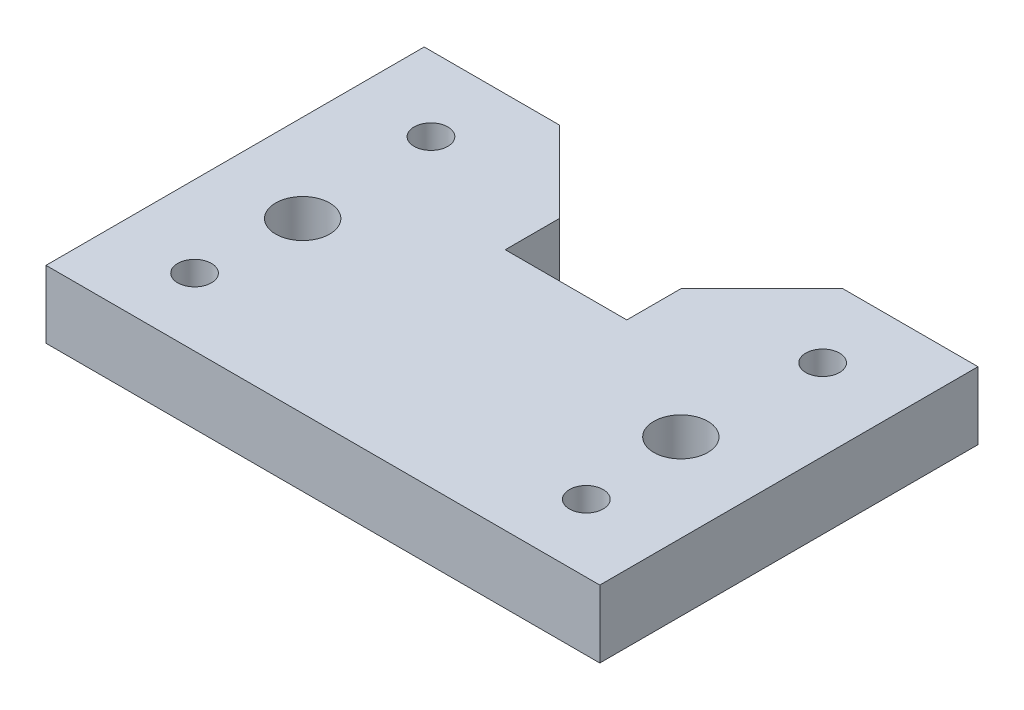
from build123d import *

# Parameters (mm, degrees)
SKETCH1_W               = 82
SKETCH1_H               = 10
BOSS_EXTRUDE1_DEPTH     = 35
CUT_EXTRUDE1_DEPTH      = 55.827000647
CUT_EXTRUDE1_DEPTH_BACK = 55.827000647
SKETCH2_R               = 4
CUT_EXTRUDE2_DEPTH      = 55.827000647
CUT_EXTRUDE2_DEPTH_BACK = 55.827000647
SKETCH3_R               = 2.5
SKETCH4_W               = 82
SKETCH4_H               = 10
BOSS_EXTRUDE2_DEPTH     = 21
CUT_EXTRUDE3_DEPTH      = 55.827000647
CUT_EXTRUDE3_DEPTH_BACK = 55.827000647
SKETCH5_R               = 2.5
CUT_EXTRUDE4_DEPTH      = 4
CUT_EXTRUDE5_DEPTH      = 55.827000647
CUT_EXTRUDE5_DEPTH_BACK = 55.827000647


with BuildPart() as part:
    # Sketch1 → Boss-Extrude1 (new body)
    with BuildSketch(Plane.XY):
        with Locations((0, -5)):
            Rectangle(SKETCH1_W, SKETCH1_H)
    extrude(amount=BOSS_EXTRUDE1_DEPTH)

    # Sketch2 → Cut-Extrude1 (cut, two sides: drawn at the far end of the back side and taken through both)
    with BuildSketch(Plane(origin=(0, 0, 0), x_dir=(1, 0, 0), z_dir=(0, 1, 0)).offset(-CUT_EXTRUDE1_DEPTH_BACK)):
        with Locations((-28, -10)):
            Circle(SKETCH2_R)
        with Locations((28, -10)):
            Circle(SKETCH2_R)
    extrude(amount=CUT_EXTRUDE1_DEPTH + CUT_EXTRUDE1_DEPTH_BACK, mode=Mode.SUBTRACT)

    # Sketch3 → Cut-Extrude2 (cut, two sides: drawn at the far end of the back side and taken through both)
    with BuildSketch(Plane(origin=(0, 0, 0), x_dir=(1, 0, 0), z_dir=(0, 1, 0)).offset(-CUT_EXTRUDE2_DEPTH_BACK)):
        with Locations((-29, -25)):
            Circle(SKETCH3_R)
        with Locations((29, -25)):
            Circle(SKETCH3_R)
    extrude(amount=CUT_EXTRUDE2_DEPTH + CUT_EXTRUDE2_DEPTH_BACK, mode=Mode.SUBTRACT)

    # Sketch4 → Boss-Extrude2 (add)
    with BuildSketch(Plane(origin=(0, 0, 0), x_dir=(-1, 0, 0), z_dir=(0, 0, -1))):
        with Locations((0, -5)):
            Rectangle(SKETCH4_W, SKETCH4_H)
    extrude(amount=BOSS_EXTRUDE2_DEPTH)

    # Sketch5 → Cut-Extrude3 (cut, two sides: drawn at the far end of the back side and taken through both)
    with BuildSketch(Plane(origin=(0, 0, 0), x_dir=(1, 0, 0), z_dir=(0, 1, 0)).offset(-CUT_EXTRUDE3_DEPTH_BACK)):
        with Locations((-29, 10)):
            Circle(SKETCH5_R)
        with Locations((29, 10)):
            Circle(SKETCH5_R)
    extrude(amount=CUT_EXTRUDE3_DEPTH + CUT_EXTRUDE3_DEPTH_BACK, mode=Mode.SUBTRACT)

    # Sketch6 → Cut-Extrude4 (cut)
    with BuildSketch(Plane.XZ.offset(10)):
        Polygon((-24.381197846, 25), (-26.690598923, 29), (-31.309401077, 29), (-33.618802154, 25), (-31.309401077, 21), (-26.690598923, 21), align=None)
        Polygon((33.618802154, 25), (31.309401077, 29), (26.690598923, 29), (24.381197846, 25), (26.690598923, 21), (31.309401077, 21), align=None)
        Polygon((-24.381197846, -10), (-26.690598923, -6), (-31.309401077, -6), (-33.618802154, -10), (-31.309401077, -14), (-26.690598923, -14), align=None)
        Polygon((33.618802154, -10), (31.309401077, -6), (26.690598923, -6), (24.381197846, -10), (26.690598923, -14), (31.309401077, -14), align=None)
    extrude(amount=-CUT_EXTRUDE4_DEPTH, mode=Mode.SUBTRACT)

    # Sketch7 → Cut-Extrude5 (cut, two sides: drawn at the far end of the back side and taken through both)
    with BuildSketch(Plane(origin=(0, 0, 0), x_dir=(1, 0, 0), z_dir=(0, 1, 0)).offset(-CUT_EXTRUDE5_DEPTH_BACK)):
        Polygon((21, 21), (-21, 21), (-9, 9), (-9, 1), (9, 1), (9, 9), align=None)
    extrude(amount=CUT_EXTRUDE5_DEPTH + CUT_EXTRUDE5_DEPTH_BACK, mode=Mode.SUBTRACT)


solid = part.part
